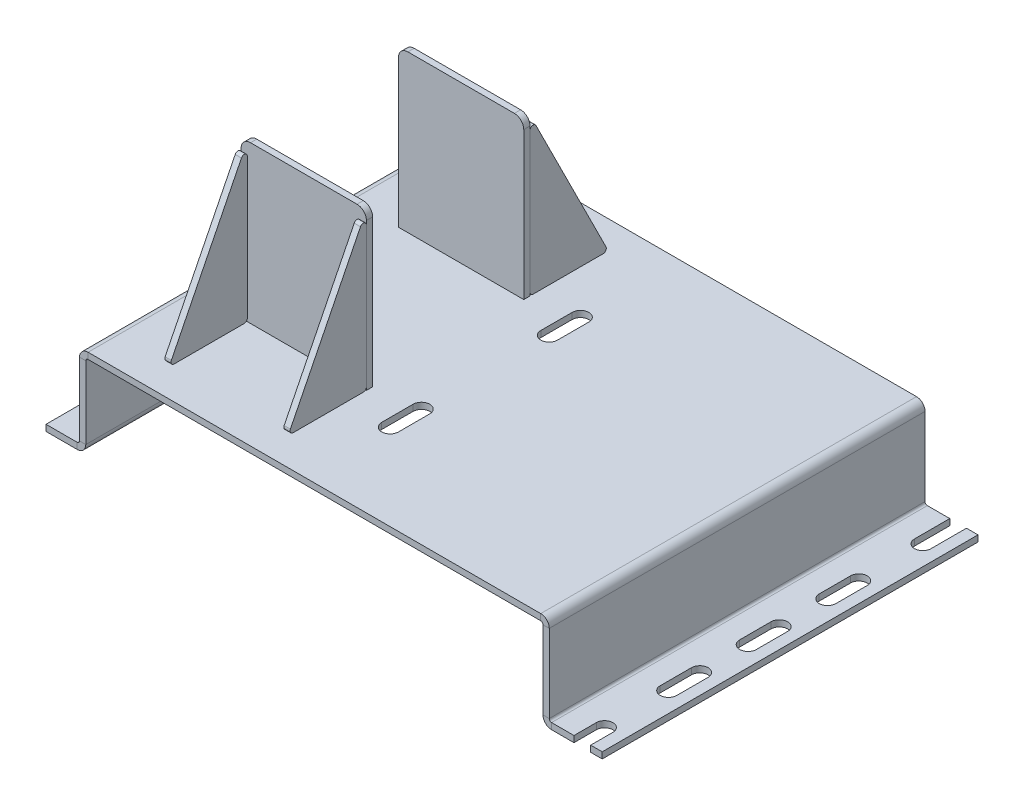
from build123d import *

# Parameters (mm, degrees)
SKETCH1_W                    = 150
SKETCH1_H                    = 120
BASE_FLANGE1_DEPTH           = 1.99
EDGE_FLANGE1_STRIP_W         = 9.4332
EDGE_FLANGE1_STRIP_H         = 1.99
EDGE_FLANGE1_STRIP_CUT_DEPTH = 120
EDGE_FLANGE1_DEPTH           = 120
EDGE_FLANGE2_STRIP_W         = 9.4332
EDGE_FLANGE2_STRIP_H         = 1.99
EDGE_FLANGE2_STRIP_CUT_DEPTH = 120
EDGE_FLANGE2_DEPTH           = 120
EDGE_FLANGE3_STRIP_W         = 9.4332
EDGE_FLANGE3_STRIP_H         = 1.99
EDGE_FLANGE3_STRIP_CUT_DEPTH = 120
EDGE_FLANGE3_DEPTH           = 120
EDGE_FLANGE4_STRIP_W         = 9.4332
EDGE_FLANGE4_STRIP_H         = 1.99
EDGE_FLANGE4_STRIP_CUT_DEPTH = 120
EDGE_FLANGE4_DEPTH           = 120
CUT_EXTRUDE1_DEPTH           = 114.892967737
SKETCH22_W                   = 40
SKETCH22_H                   = 1.99
BOSS_EXTRUDE1_DEPTH          = 50
BOSS_EXTRUDE1_2_DEPTH        = 50
BOSS_EXTRUDE2_START          = -17.2734
BOSS_EXTRUDE2_DEPTH          = 1.99
BOSS_EXTRUDE2_2_DEPTH        = 1.99
BOSS_EXTRUDE3_START          = -57.2734
BOSS_EXTRUDE3_DEPTH          = 1.99
BOSS_EXTRUDE3_2_DEPTH        = 1.99
FILLET1_R                    = 3
FILLET2_R                    = 3


# Sheet-metal steps are written as plain solids
with BuildPart() as part:
    # Sketch1 → Base-Flange1 (new body)
    with BuildSketch(Plane(origin=(0, 0, 0), x_dir=(1, 0, 0), z_dir=(0, 1, 0))):
        Rectangle(SKETCH1_W, SKETCH1_H)
    extrude(amount=-BASE_FLANGE1_DEPTH)

    # Edge-Flange1 strip (across the edge) → Edge-Flange1 strip cut (cut)
    with BuildSketch(Plane(origin=(75, -1.99, -60), x_dir=(-1, 0, 0), z_dir=(0, 0, 1))):
        with Locations((-1.99, -0.995)):
            Rectangle(EDGE_FLANGE1_STRIP_W, EDGE_FLANGE1_STRIP_H)
    extrude(amount=EDGE_FLANGE1_STRIP_CUT_DEPTH, mode=Mode.SUBTRACT)

    # Edge-Flange1 section (across the edge) → Edge-Flange1 (add)
    with BuildSketch(Plane(origin=(75, -1.99, -60), x_dir=(-1, 0, 0), z_dir=(0, 0, 1))):
        with BuildLine():
            Line((0, 0.7366), (0, 28.41))
            Line((0, 28.41), (1.99, 28.41))
            Line((1.99, 28.41), (1.99, 0.7366))
            ThreePointArc((1.99, 0.7366), (2.205745145, 0.215745145), (2.7266, 0))
            Line((2.7266, 0), (2.7266, -1.99))
            ThreePointArc((2.7266, -1.99), (0.79860265, -1.19139735), (0, 0.7366))
        make_face()
    extrude(amount=EDGE_FLANGE1_DEPTH)

    # Edge-Flange2 strip (across the edge) → Edge-Flange2 strip cut (cut)
    with BuildSketch(Plane(origin=(75, -30.4, 60), x_dir=(0, 1, 0), z_dir=(0, 0, -1))):
        with Locations((-1.99, -0.995)):
            Rectangle(EDGE_FLANGE2_STRIP_W, EDGE_FLANGE2_STRIP_H)
    extrude(amount=EDGE_FLANGE2_STRIP_CUT_DEPTH, mode=Mode.SUBTRACT)

    # Edge-Flange2 section (across the edge) → Edge-Flange2 (add)
    with BuildSketch(Plane(origin=(75, -30.4, 60), x_dir=(0, 1, 0), z_dir=(0, 0, -1))):
        with BuildLine():
            Line((0, 0.7366), (0, 16.91))
            Line((0, 16.91), (1.99, 16.91))
            Line((1.99, 16.91), (1.99, 0.7366))
            ThreePointArc((1.99, 0.7366), (2.205745145, 0.215745145), (2.7266, 0))
            Line((2.7266, 0), (2.7266, -1.99))
            ThreePointArc((2.7266, -1.99), (0.79860265, -1.19139735), (0, 0.7366))
        make_face()
    extrude(amount=EDGE_FLANGE2_DEPTH)

    # Edge-Flange3 strip (across the edge) → Edge-Flange3 strip cut (cut)
    with BuildSketch(Plane(origin=(-75, -1.99, 60), x_dir=(1, 0, 0), z_dir=(0, 0, -1))):
        with Locations((-1.99, -0.995)):
            Rectangle(EDGE_FLANGE3_STRIP_W, EDGE_FLANGE3_STRIP_H)
    extrude(amount=EDGE_FLANGE3_STRIP_CUT_DEPTH, mode=Mode.SUBTRACT)

    # Edge-Flange3 section (across the edge) → Edge-Flange3 (add)
    with BuildSketch(Plane(origin=(-75, -1.99, 60), x_dir=(1, 0, 0), z_dir=(0, 0, -1))):
        with BuildLine():
            Line((0, 0.7366), (0, 26.64))
            Line((0, 26.64), (1.99, 26.64))
            Line((1.99, 26.64), (1.99, 0.7366))
            ThreePointArc((1.99, 0.7366), (2.205745145, 0.215745145), (2.7266, 0))
            Line((2.7266, 0), (2.7266, -1.99))
            ThreePointArc((2.7266, -1.99), (0.79860265, -1.19139735), (0, 0.7366))
        make_face()
    extrude(amount=EDGE_FLANGE3_DEPTH)

    # Edge-Flange4 strip (across the edge) → Edge-Flange4 strip cut (cut)
    with BuildSketch(Plane(origin=(-75, -28.63, -60), x_dir=(0, 1, 0), z_dir=(0, 0, 1))):
        with Locations((-1.99, -0.995)):
            Rectangle(EDGE_FLANGE4_STRIP_W, EDGE_FLANGE4_STRIP_H)
    extrude(amount=EDGE_FLANGE4_STRIP_CUT_DEPTH, mode=Mode.SUBTRACT)

    # Edge-Flange4 section (across the edge) → Edge-Flange4 (add)
    with BuildSketch(Plane(origin=(-75, -28.63, -60), x_dir=(0, 1, 0), z_dir=(0, 0, 1))):
        with BuildLine():
            Line((0, 0.7366), (0, 10.71))
            Line((0, 10.71), (1.99, 10.71))
            Line((1.99, 10.71), (1.99, 0.7366))
            ThreePointArc((1.99, 0.7366), (2.205745145, 0.215745145), (2.7266, 0))
            Line((2.7266, 0), (2.7266, -1.99))
            ThreePointArc((2.7266, -1.99), (0.79860265, -1.19139735), (0, 0.7366))
        make_face()
    extrude(amount=EDGE_FLANGE4_DEPTH)

    # Sketch20 → Cut-Extrude1 (cut, through all)
    with BuildSketch(Plane(origin=(0, -30.4, 0), x_dir=(-1, 0, 0), z_dir=(0, -1, 0))):
        with BuildLine():
            Line((6.007, -32.488), (6.007, -22.488))
            ThreePointArc((6.007, -22.488), (3.34, -19.821), (0.673, -22.488))
            Line((0.673, -22.488), (0.673, -32.488))
            ThreePointArc((0.673, -32.488), (3.34, -35.155), (6.007, -32.488))
        make_face()
        with BuildLine():
            Line((-82.893, -60), (-82.893, -52.888))
            ThreePointArc((-82.893, -52.888), (-85.56, -50.221), (-88.227, -52.888))
            Line((-88.227, -52.888), (-88.227, -60))
            Line((-88.227, -60), (-82.893, -60))
        make_face()
        with BuildLine():
            Line((-82.893, -7.088), (-82.893, 2.912))
            ThreePointArc((-82.893, 2.912), (-85.56, 5.579), (-88.227, 2.912))
            Line((-88.227, 2.912), (-88.227, -7.088))
            ThreePointArc((-88.227, -7.088), (-85.56, -9.755), (-82.893, -7.088))
        make_face()
        with BuildLine():
            Line((-82.893, 18.312), (-82.893, 28.312))
            ThreePointArc((-82.893, 28.312), (-85.56, 30.979), (-88.227, 28.312))
            Line((-88.227, 28.312), (-88.227, 18.312))
            ThreePointArc((-88.227, 18.312), (-85.56, 15.645), (-82.893, 18.312))
        make_face()
        with BuildLine():
            Line((-88.227, 60), (-88.227, 48.712))
            ThreePointArc((-88.227, 48.712), (-85.56, 46.045), (-82.893, 48.712))
            Line((-82.893, 48.712), (-82.893, 60))
            Line((-82.893, 60), (-88.227, 60))
        make_face()
        with BuildLine():
            ThreePointArc((6.007, 28.312), (3.34, 30.979), (0.673, 28.312))
            Line((0.673, 28.312), (0.673, 18.312))
            ThreePointArc((0.673, 18.312), (3.34, 15.645), (6.007, 18.312))
            Line((6.007, 18.312), (6.007, 28.312))
        make_face()
        with BuildLine():
            Line((-82.893, -32.488), (-82.893, -22.488))
            ThreePointArc((-82.893, -22.488), (-85.56, -19.821), (-88.227, -22.488))
            Line((-88.227, -22.488), (-88.227, -32.488))
            ThreePointArc((-88.227, -32.488), (-85.56, -35.155), (-82.893, -32.488))
        make_face()
    extrude(amount=-CUT_EXTRUDE1_DEPTH, mode=Mode.SUBTRACT)


with BuildPart() as body_2:
    # Sketch22 → Boss-Extrude1 (new body)
    with BuildSketch(Plane(origin=(0, 0, 0), x_dir=(1, 0, 0), z_dir=(0, 1, 0))):
        with Locations((-37.2734, 25.125)):
            Rectangle(SKETCH22_W, SKETCH22_H)
    extrude(amount=BOSS_EXTRUDE1_DEPTH)

    # Fillet2
    fillet2_edges = [body_2.edges().sort_by_distance(p)[0] for p in [
        (-57.2734, 50, -25.125),
        (-17.2734, 50, -25.125),
    ]]
    fillet(fillet2_edges, radius=FILLET2_R)


with BuildPart() as body_3:
    # Sketch22 → Boss-Extrude1 2 (new body)
    with BuildSketch(Plane(origin=(0, 0, 0), x_dir=(1, 0, 0), z_dir=(0, 1, 0))):
        with Locations((-37.2734, -25.125)):
            Rectangle(SKETCH22_W, SKETCH22_H)
    extrude(amount=BOSS_EXTRUDE1_2_DEPTH)

    # Fillet1
    fillet1_edges = [body_3.edges().sort_by_distance(p)[0] for p in [
        (-57.2734, 50, 25.125),
        (-17.2734, 50, 25.125),
    ]]
    fillet(fillet1_edges, radius=FILLET1_R)


with BuildPart() as body_4:
    # Sketch27 → Boss-Extrude2 (new body)
    with BuildSketch(Plane(origin=(0, 0, 0), x_dir=(0, 0, -1), z_dir=(1, 0, 0)).offset(BOSS_EXTRUDE2_START)):
        with BuildLine():
            Line((-28.014427191, 46.211145618), (-50.396393202, 1.447213595))
            ThreePointArc((-50.396393202, 1.447213595), (-50.35261682, 0.474268888), (-49.501966011, 0))
            Line((-49.501966011, 0), (-27.12, 0))
            ThreePointArc((-27.12, 0), (-26.412893219, 0.292893219), (-26.12, 1))
            Line((-26.12, 1), (-26.12, 45.763932023))
            ThreePointArc((-26.12, 45.763932023), (-26.890247079, 46.737181012), (-28.014427191, 46.211145618))
        make_face()
    extrude(amount=-BOSS_EXTRUDE2_DEPTH)


with BuildPart() as body_5:
    # Sketch27 → Boss-Extrude2 2 (new body)
    with BuildSketch(Plane(origin=(0, 0, 0), x_dir=(0, 0, -1), z_dir=(1, 0, 0)).offset(BOSS_EXTRUDE2_START)):
        with BuildLine():
            Line((49.501966011, 0), (27.12, 0))
            ThreePointArc((27.12, 0), (26.412893219, 0.292893219), (26.12, 1))
            Line((26.12, 1), (26.12, 45.763932023))
            ThreePointArc((26.12, 45.763932023), (26.890247079, 46.737181012), (28.014427191, 46.211145618))
            Line((28.014427191, 46.211145618), (50.396393202, 1.447213595))
            ThreePointArc((50.396393202, 1.447213595), (50.35261682, 0.474268888), (49.501966011, 0))
        make_face()
    extrude(amount=-BOSS_EXTRUDE2_2_DEPTH)


with BuildPart() as body_6:
    # Sketch27<2> → Boss-Extrude3 (new body)
    with BuildSketch(Plane(origin=(0, 0, 0), x_dir=(0, 0, -1), z_dir=(1, 0, 0)).offset(BOSS_EXTRUDE3_START)):
        with BuildLine():
            Line((-28.014427191, 46.211145618), (-50.396393202, 1.447213595))
            ThreePointArc((-50.396393202, 1.447213595), (-50.35261682, 0.474268888), (-49.501966011, 0))
            Line((-49.501966011, 0), (-27.12, 0))
            ThreePointArc((-27.12, 0), (-26.412893219, 0.292893219), (-26.12, 1))
            Line((-26.12, 1), (-26.12, 45.763932023))
            ThreePointArc((-26.12, 45.763932023), (-26.890247079, 46.737181012), (-28.014427191, 46.211145618))
        make_face()
    extrude(amount=BOSS_EXTRUDE3_DEPTH)


with BuildPart() as body_7:
    # Sketch27<2> → Boss-Extrude3 2 (new body)
    with BuildSketch(Plane(origin=(0, 0, 0), x_dir=(0, 0, -1), z_dir=(1, 0, 0)).offset(BOSS_EXTRUDE3_START)):
        with BuildLine():
            Line((49.501966011, 0), (27.12, 0))
            ThreePointArc((27.12, 0), (26.412893219, 0.292893219), (26.12, 1))
            Line((26.12, 1), (26.12, 45.763932023))
            ThreePointArc((26.12, 45.763932023), (26.890247079, 46.737181012), (28.014427191, 46.211145618))
            Line((28.014427191, 46.211145618), (50.396393202, 1.447213595))
            ThreePointArc((50.396393202, 1.447213595), (50.35261682, 0.474268888), (49.501966011, 0))
        make_face()
    extrude(amount=BOSS_EXTRUDE3_2_DEPTH)


solid = Compound([part.part, body_2.part, body_3.part, body_4.part, body_5.part, body_6.part, body_7.part])
